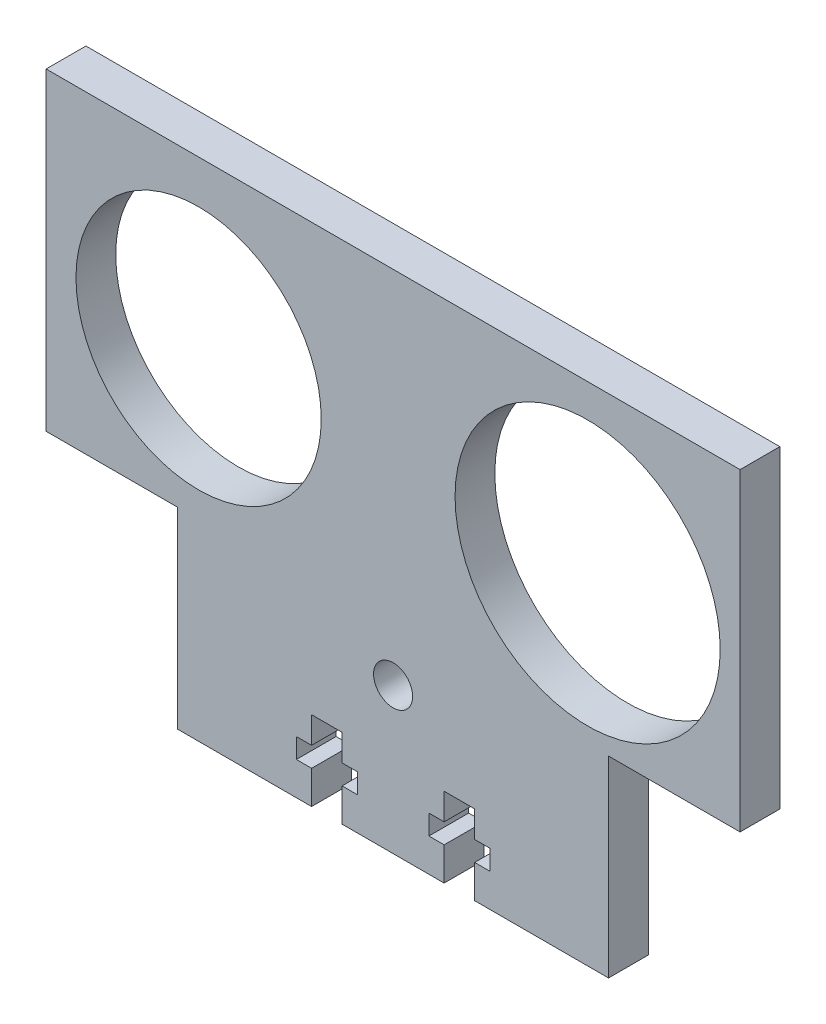
from build123d import *

# Parameters (mm, degrees)
SKETCH1_R           = 2.95
SKETCH1_R_2         = 20
SKETCH1_R_3         = 18.5
BOSS_EXTRUDE1_DEPTH = 6
CUT_EXTRUDE2_DEPTH  = 76.692558526


with BuildPart() as part:
    # Sketch1 → Boss-Extrude1 (new body)
    with BuildSketch(Plane.XY):
        Polygon((-32.5, 7), (-32.5, -22), (32.5, -22), (32.5, 7), (52.344931419, 7), (52.344931419, 54.344931419), (-52.344931419, 54.344931419), (-52.344931419, 7), align=None)
        Circle(SKETCH1_R, mode=Mode.SUBTRACT)
        with Locations((29.344931419, 29.344931419)):
            Circle(SKETCH1_R_2, mode=Mode.SUBTRACT)
        with Locations((-29.344931419, 29.344931419)):
            Circle(SKETCH1_R_3, mode=Mode.SUBTRACT)
    extrude(amount=BOSS_EXTRUDE1_DEPTH)

    # Sketch3 → Cut-Extrude2 (cut, through all)
    with BuildSketch(Plane.XY.offset(6)):
        Polygon((-12.3, -22), (-7.7, -22), (-7.7, -17), (-5.4, -17), (-5.4, -14), (-7.7, -14), (-7.7, -10), (-12.3, -10), (-12.3, -14), (-14.6, -14), (-14.6, -17), (-12.3, -17), align=None)
        Polygon((7.7, -14), (7.7, -10), (12.3, -10), (12.3, -14), (14.6, -14), (14.6, -17), (12.3, -17), (12.3, -22), (7.7, -22), (7.7, -17), (5.4, -17), (5.4, -14), align=None)
    extrude(amount=-CUT_EXTRUDE2_DEPTH, mode=Mode.SUBTRACT)


solid = part.part
